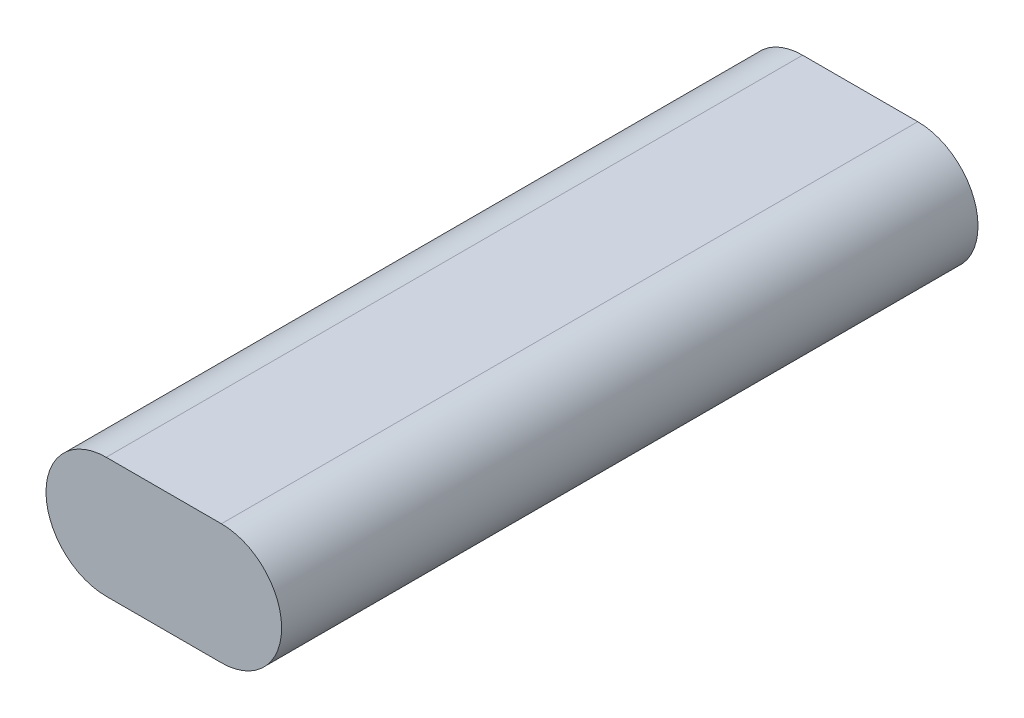
from build123d import *

# Parameters (mm, degrees)
EXTRUSION1_DEPTH = 133
EXTRUSION2_DEPTH = 1
CHANFREIN1_SIZE  = 1
EXTRUSION3_DEPTH = 3
EXTRUSION4_DEPTH = 10


with BuildPart() as part:
    # Esquisse1 → Extrusion1 (new body)
    with BuildSketch(Plane.XY):
        with BuildLine():
            Line((0, 11.5), (22, 11.5))
            ThreePointArc((22, 11.5), (33.5, 0), (22, -11.5))
            Line((22, -11.5), (0, -11.5))
            ThreePointArc((0, -11.5), (-11.5, 0), (0, 11.5))
        make_face()
    extrude(amount=EXTRUSION1_DEPTH)

    # Esquisse2 → Extrusion2 (add)
    with BuildSketch(Plane(origin=(0, 0, 0), x_dir=(-1, 0, 0), z_dir=(0, 0, -1))):
        with BuildLine():
            Line((-22, 5), (0, 5))
            ThreePointArc((0, 5), (5, 0), (0, -5))
            Line((0, -5), (-22, -5))
            ThreePointArc((-22, -5), (-27, 0), (-22, 5))
        make_face()
    extrude(amount=EXTRUSION2_DEPTH)

    # Chanfrein1
    chanfrein1_edges = [part.edges().sort_by_distance(p)[0] for p in [
        (11, 5, 0),
        (-5, 0, 0),
        (27, 0, 0),
        (11, -5, 0),
    ]]
    chamfer(chanfrein1_edges, length=CHANFREIN1_SIZE - 0.0001)  # a hair under: the kernel refuses the full size

    # Esquisse3 → Extrusion3 (add)
    with BuildSketch(Plane(origin=(0, 0, -1), x_dir=(-1, 0, 0), z_dir=(0, 0, -1))):
        with BuildLine():
            Line((-13, 4), (-9, 4))
            ThreePointArc((-9, 4), (-5, 0), (-9, -4))
            Line((-9, -4), (-13, -4))
            ThreePointArc((-13, -4), (-17, 0), (-13, 4))
        make_face()
    extrude(amount=EXTRUSION3_DEPTH)

    # Esquisse4 → Extrusion4 (cut)
    with BuildSketch(Plane(origin=(0, 0, -4), x_dir=(-1, 0, 0), z_dir=(0, 0, -1))):
        with BuildLine():
            Line((-13, 2.5), (-9, 2.5))
            ThreePointArc((-9, 2.5), (-6.5, 0), (-9, -2.5))
            Line((-9, -2.5), (-13, -2.5))
            ThreePointArc((-13, -2.5), (-15.5, 0), (-13, 2.5))
        make_face()
    extrude(amount=-EXTRUSION4_DEPTH, mode=Mode.SUBTRACT)


solid = part.part
